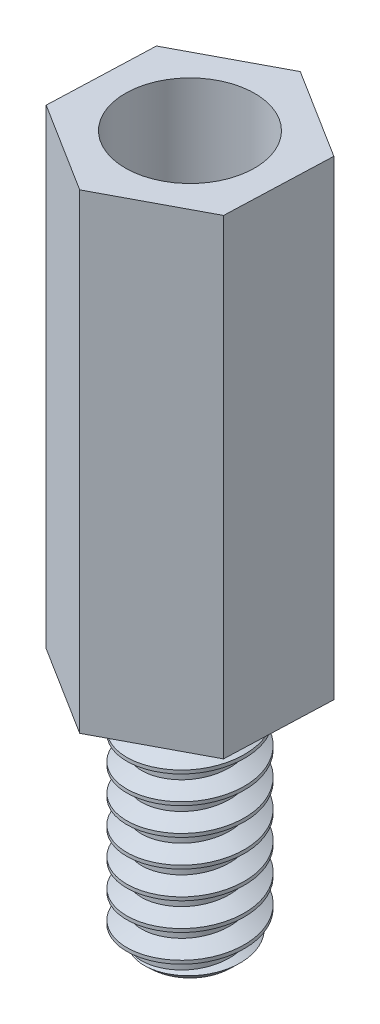
from build123d import *
from build123d.topology import SkipClean

# Parameters (mm, degrees)
BOSS_EXTRUDE1_DEPTH   = 12
M4_TAPPED_HOLE1_D     = 3.3
M4_TAPPED_HOLE1_DEPTH = 6
M4_TAPPED_HOLE1_TIP   = 0.991420021
SKETCH4_R             = 1.5
BOSS_EXTRUDE2_DEPTH   = 6
FILLET1_SIZE          = 0.5
THREAD1_PITCH         = 0.7


with BuildPart() as part:
    # Sketch1 → Boss-Extrude1 (new body)
    with BuildSketch(Plane(origin=(0, 0, 0), x_dir=(1, 0, 0), z_dir=(0, 1, 0))):
        Polygon((2.298297329, -1.442623554), (2.398497311, 1.269072095), (0.100199982, 2.71169565), (-2.298297329, 1.442623554), (-2.398497311, -1.269072095), (-0.100199982, -2.71169565), align=None)
    extrude(amount=BOSS_EXTRUDE1_DEPTH)

    # M4 Tapped Hole1
    with Locations(Plane(origin=(0, 12, 0), x_dir=(1, 0, 0), z_dir=(0, 1, 0))):
        with Locations((0, 0)):
            Hole(M4_TAPPED_HOLE1_D / 2, depth=M4_TAPPED_HOLE1_DEPTH)
            with Locations((0, 0, -(M4_TAPPED_HOLE1_DEPTH + M4_TAPPED_HOLE1_TIP / 2))):  # 118° drill point
                Cone(0, M4_TAPPED_HOLE1_D / 2, M4_TAPPED_HOLE1_TIP, mode=Mode.SUBTRACT)

    # Sketch4 → Boss-Extrude2 (add)
    with BuildSketch(Plane.XZ):
        with Locations(Location((0, 0, 0), (0, 0, 270))):
            Circle(SKETCH4_R)
    extrude(amount=BOSS_EXTRUDE2_DEPTH)

    # Fillet1
    # a fillet whose section is not a circle: 0.5 mm, written as the material it takes off along each edge
    with BuildSketch(Plane(origin=(0, -6, 0), x_dir=(0, 0, -1), z_dir=(-1, 0, 0))) as fillet1_piece_1:
        with BuildLine():
            Bezier((1.5, -FILLET1_SIZE), (1.5, 0), (1.5 - FILLET1_SIZE, 0), weights=[1, 0.035355339, 1])
            Line((1.5 - FILLET1_SIZE, 0), (1.5, 0))
            Line((1.5, 0), (1.5, -FILLET1_SIZE))
        make_face()
    revolve(axis=Axis((0, -6, 0), (0, -1, 0)), mode=Mode.SUBTRACT)

    # Thread1: arcs per turn and ends read off the stored shape
    # Thread1: the profile of Thread Profile1 profile screwed along a right-hand helix through 8.571429 turns, 6 arcs to a turn; built about Z, then put on its axis
    with SkipClean():  # the faces are left unmerged after this step: merging them gives an invalid solid
        thread1_z = Axis((0, 0, 0), (0, 0, 1))
        thread1_corners = [(1.5003, 0, -0.000173205), (1.5003, 0, 0.612673203), (1.121113888, 0, 0.393749999), (1.121113888, 0, 0.218749999)]
        with BuildLine(mode=Mode.PRIVATE) as thread1_profile:
            Line(thread1_corners[0], thread1_corners[1])
            Line(thread1_corners[1], thread1_corners[2])
            Line(thread1_corners[2], thread1_corners[3])
            Line(thread1_corners[3], thread1_corners[0])
        thread1_cap = Face(thread1_profile.wire())
        thread1_turn_angles = [0, 30, 60, 90, 120, 150, 180, 210, 240, 270, 300, 330, 360]
        thread1_turn_weights = [1, 0.8660254037844387, 1, 0.8660254037844387, 1, 0.8660254037844387, 1, 0.8660254037844387, 1, 0.8660254037844387, 1, 0.8660254037844387, 1]
        thread1_turn_rails = [Edge.make_bspline([Vector(p[0], p[1], 0).rotate(thread1_z, thread1_turn_angles[k]) / thread1_turn_weights[k] + Vector(0, 0, p[2] + THREAD1_PITCH * thread1_turn_angles[k] / 360) for k in range(13)], [0, 0, 0, 1, 1, 2, 2, 3, 3, 4, 4, 5, 5, 6, 6, 6], 2, thread1_turn_weights) for p in thread1_corners]
        thread1_turn_sides = [Face.make_surface_from_curves(thread1_turn_rails[p[0]], thread1_turn_rails[p[1]]) for p in [(0, 1), (1, 2), (2, 3), (3, 0)]]
        thread1_last_angles = [2880, 2910, 2940, 2970, 3000, 3030, 3060, 3072.857142857, 3085.714285714]
        thread1_last_weights = [1, 0.8660254037844387, 1, 0.8660254037844387, 1, 0.8660254037844387, 1, 0.9749279121818235, 1]
        thread1_last_rails = [Edge.make_bspline([Vector(p[0], p[1], 0).rotate(thread1_z, thread1_last_angles[k]) / thread1_last_weights[k] + Vector(0, 0, p[2] + THREAD1_PITCH * thread1_last_angles[k] / 360) for k in range(9)], [0, 0, 0, 1, 1, 2, 2, 3, 3, 4, 4, 4], 2, thread1_last_weights) for p in thread1_corners]
        thread1_last_sides = [Face.make_surface_from_curves(thread1_last_rails[p[0]], thread1_last_rails[p[1]]) for p in [(0, 1), (1, 2), (2, 3), (3, 0)]]
        thread1 = Plane(origin=(0, 0, 0), x_dir=(-1, 0, 0), z_dir=(0, -1, 0)) * Solid(Shell([*[p.moved(Location((0, 0, THREAD1_PITCH * i))) for i in range(8) for p in thread1_turn_sides], *thread1_last_sides, thread1_cap, thread1_cap.rotate(thread1_z, 3085.714285714).moved(Location((0, 0, THREAD1_PITCH * 3085.714285714 / 360)))]))
        add(thread1, mode=Mode.SUBTRACT)


solid = part.part
